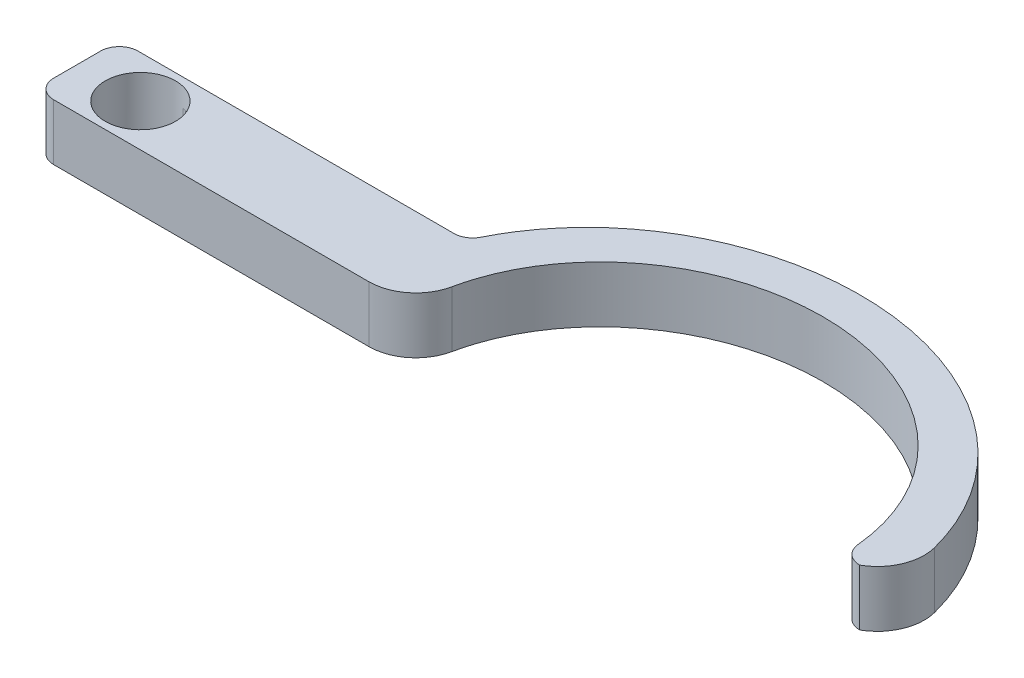
from build123d import *

# Parameters (mm, degrees)
SKETCH_2_W      = 37
SKETCH_2_H      = 9
EXTRUDE_1_DEPTH = 6
EXTRUDE_2_DEPTH = 2
FILLET_1_R      = 2
FILLET_START    = -7
FILLET_2_DEPTH  = 8


with BuildPart() as part:
    # 草图2 → 凸台-拉伸1 (new body)
    # profile 1 of 2: a face of its own
    with BuildSketch(Plane(origin=(0, 0, 0), x_dir=(1, 0, 0), z_dir=(0, 1, 0))):
        with Locations((11.75, 0)):
            Rectangle(SKETCH_2_W, SKETCH_2_H)
        with BuildLine():
            ThreePointArc((0, -3.75), (-3.75, 0), (0, 3.75))
            ThreePointArc((0, 3.75), (0.467803008, 3.720706969), (0.928297552, 3.633285518))
            Line((0.928297552, 3.633285518), (17.19959595, 1.58750164))
            ThreePointArc((17.19959595, 1.58750164), (18.6, 0), (17.19959595, -1.58750164))
            Line((17.19959595, -1.58750164), (0.928297552, -3.633285518))
            ThreePointArc((0.928297552, -3.633285518), (0.467803008, -3.720706969), (0, -3.75))
        make_face(mode=Mode.SUBTRACT)
    # profile 2 of 2: a face of its own
    with BuildSketch(Plane(origin=(0, 0, 0), x_dir=(1, 0, 0), z_dir=(0, 1, 0))):
        with BuildLine():
            add(Edge.make_bspline(
                [(84.372664489, -4.5), (84.372664489, 16.273797371), (61.499329794, 20.077379737), (38.6259951, 23.880962103), (30.25, 4.5)],
                knots=[0, 0, 0, 1.38666238, 1.38666238, 2.77332476, 2.77332476, 2.77332476], degree=2, weights=[1, 0.769121313, 1, 0.769121313, 1]))
            Line((30.25, 4.5), (30.25, -4.5))
            Line((30.25, -4.5), (33.372664489, -4.5))
            add(Edge.make_bspline(
                [(79.372664489, -4.5), (79.372664489, 16.5), (56.372664489, 16.5), (33.372664489, 16.5), (33.372664489, -4.5)],
                knots=[3.141592654, 3.141592654, 3.141592654, 4.71238898, 4.71238898, 6.283185307, 6.283185307, 6.283185307], degree=2, weights=[1, 0.707106781, 1, 0.707106781, 1]))
            Line((79.372664489, -4.5), (84.372664489, -4.5))
        make_face()
    extrude(amount=-EXTRUDE_1_DEPTH)

    # 草图2<3> → 凸台-拉伸2 (add)
    with BuildSketch(Plane(origin=(0, 0, 0), x_dir=(1, 0, 0), z_dir=(0, 1, 0))):
        with BuildLine():
            Line((17.19959595, 1.58750164), (0.928297552, 3.633285518))
            ThreePointArc((0.928297552, 3.633285518), (2.961723807, 2.300150449), (3.75, 0))
            ThreePointArc((3.75, 0), (2.961723807, -2.300150449), (0.928297552, -3.633285518))
            Line((0.928297552, -3.633285518), (17.19959595, -1.58750164))
            ThreePointArc((17.19959595, -1.58750164), (18.6, 0), (17.19959595, 1.58750164))
        make_face()
    extrude(amount=-EXTRUDE_2_DEPTH)

    # 圆角1
    fillet_1_edges = [part.edges().sort_by_distance(p)[0] for p in [
        (79.372664489, -3, 4.5),
        (30.25, -3, -4.5),
        (-6.75, -3, -4.5),
        (-6.75, -3, 4.5),
    ]]
    fillet(fillet_1_edges, radius=FILLET_1_R)

    # 圆角2: read off the stored shape, not the designer's step
    # 圆角2 outline → 圆角2 (cut)
    with BuildSketch(Plane(origin=(0, 0, 0), x_dir=(1, 0, 0), z_dir=(0, 1, 0)).offset(FILLET_START)):
        with BuildLine():
            ThreePointArc((83.6611587, 1.100007097), (83.419749176, -2.104342966), (81.278029013, -4.5))
            Line((81.278029013, -4.5), (84.372664489, -4.5))
            add(Edge.make_bspline(
                [(84.372664489, -4.5), (84.372664489, -1.663963299), (83.6611587, 1.100007097)],
                knots=[0, 0, 0, 0.235946278, 0.235946278, 0.235946278], degree=2, weights=[1, 0.961343445, 0.936074477]))
        make_face()
        with BuildLine():
            ThreePointArc((33.787136041, -0.531263006), (32.044537767, -3.383060329), (28.894642136, -4.5))
            Line((28.894642136, -4.5), (33.372664489, -4.5))
            add(Edge.make_bspline(
                [(33.787136041, -0.531263006), (33.372664489, -2.49758928), (33.372664489, -4.5)],
                knots=[2.938766491, 2.938766491, 2.938766491, 3.141592654, 3.141592654, 3.141592654], degree=2, weights=[0.93602739, 0.963116581, 1]))
        make_face()
    extrude(amount=FILLET_2_DEPTH, mode=Mode.SUBTRACT)


solid = part.part
